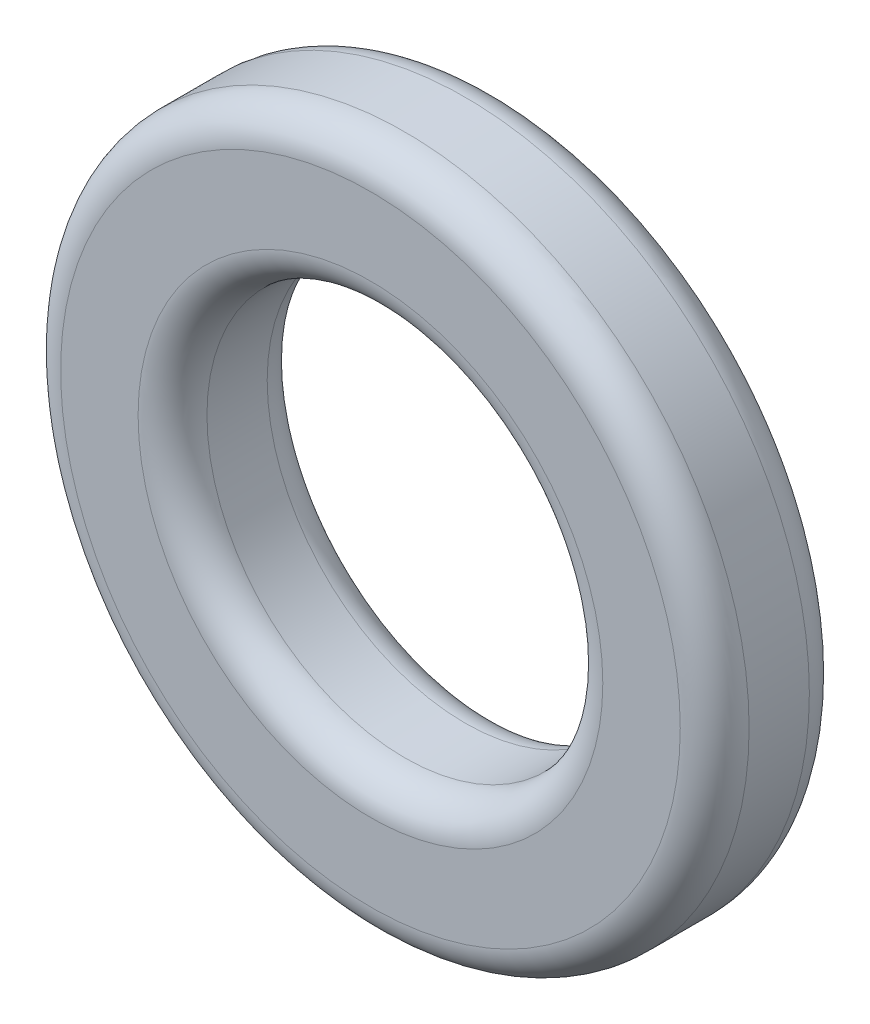
from build123d import *

# Parameters (mm, degrees)
SKETCH2_R           = 4
SKETCH2_R_2         = 2.3
BOSS_EXTRUDE1_DEPTH = 1.5
FILLET1_R           = 0.4


with BuildPart() as part:
    # Sketch2 → Boss-Extrude1 (new body)
    with BuildSketch(Plane.XY):
        Circle(SKETCH2_R)
        Circle(SKETCH2_R_2, mode=Mode.SUBTRACT)
    extrude(amount=BOSS_EXTRUDE1_DEPTH)

    # Fillet1
    fillet1_edges = [part.edges().sort_by_distance(p)[0] for p in [
        (-2.3, 0, 0),
        (-4, 0, 0),
        (-2.3, 0, 1.5),
        (-4, 0, 1.5),
    ]]
    fillet(fillet1_edges, radius=FILLET1_R)


solid = part.part
